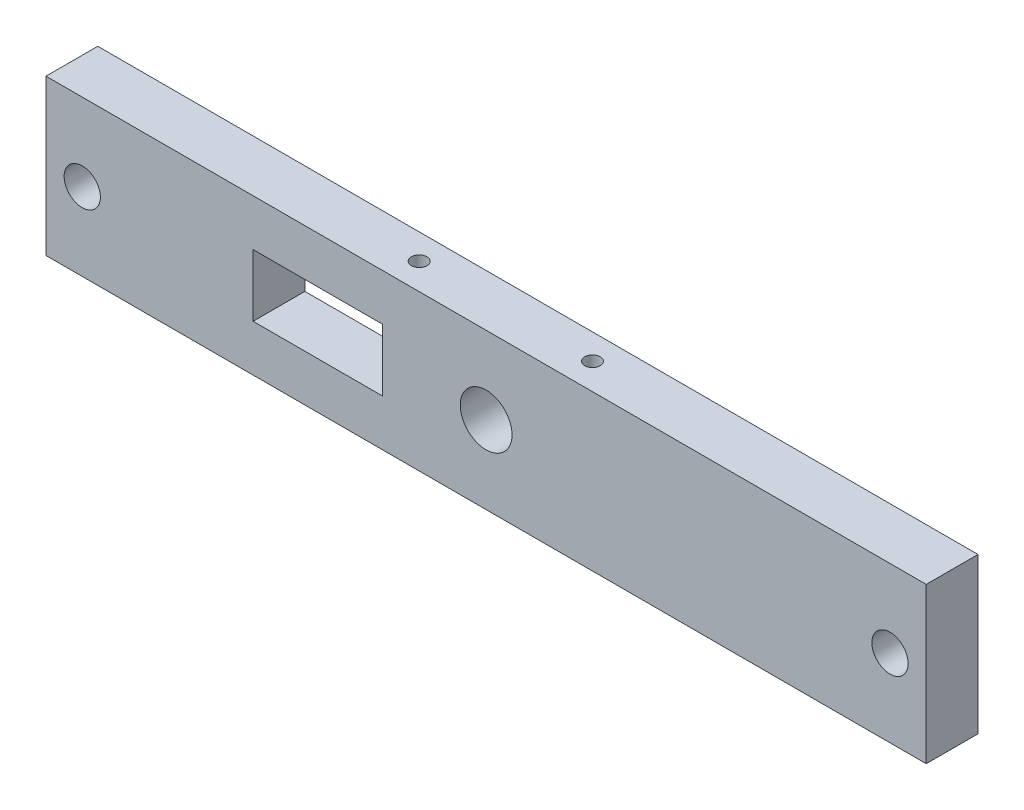
from build123d import *

# Parameters (mm, degrees)
ESBO_O1_W                 = 170
ESBO_O1_H                 = 30
ESBO_O1_R                 = 5
ESBO_O1_R_2               = 3.5
ESBO_O1_W_2               = 25
ESBO_O1_H_2               = 12
RESSALTO_EXTRUS_O1_DEPTH  = 10
CORTE_EXTRUS_O1_START     = 26.451612903
CORTE_EXTRUS_O1_OUTLINE_R = 1.5
CORTE_EXTRUS_O1_DEPTH     = 30


# Read off the part's stored shape, not the designer's step: Corte-extrusão1
with BuildPart() as part:
    # Esboço1 → Ressalto-extrusão1 (new body)
    with BuildSketch(Plane.XY):
        with Locations((-192.217741935, 41.451612903)):
            Rectangle(ESBO_O1_W, ESBO_O1_H)
        with Locations((-192.217741935, 41.451612903)):
            Circle(ESBO_O1_R, mode=Mode.SUBTRACT)
        with Locations((-270.217741935, 41.451612903)):
            Circle(ESBO_O1_R_2, mode=Mode.SUBTRACT)
        with Locations((-114.217741935, 41.451612903)):
            Circle(ESBO_O1_R_2, mode=Mode.SUBTRACT)
        with Locations((-224.717741935, 41.451612903)):
            Rectangle(ESBO_O1_W_2, ESBO_O1_H_2, mode=Mode.SUBTRACT)
    extrude(amount=RESSALTO_EXTRUS_O1_DEPTH)

    # Corte-extrusão1 outline → Corte-extrusão1 (cut)
    with BuildSketch(Plane(origin=(0, 0, 0), x_dir=(1, 0, 0), z_dir=(0, 1, 0)).offset(CORTE_EXTRUS_O1_START)):
        with Locations((-210.23272287, -4.918113723)):
            Circle(CORTE_EXTRUS_O1_OUTLINE_R)
        with Locations((-176.768107745, -4.912217988)):
            Circle(CORTE_EXTRUS_O1_OUTLINE_R)
    extrude(amount=CORTE_EXTRUS_O1_DEPTH, mode=Mode.SUBTRACT)


solid = part.part
